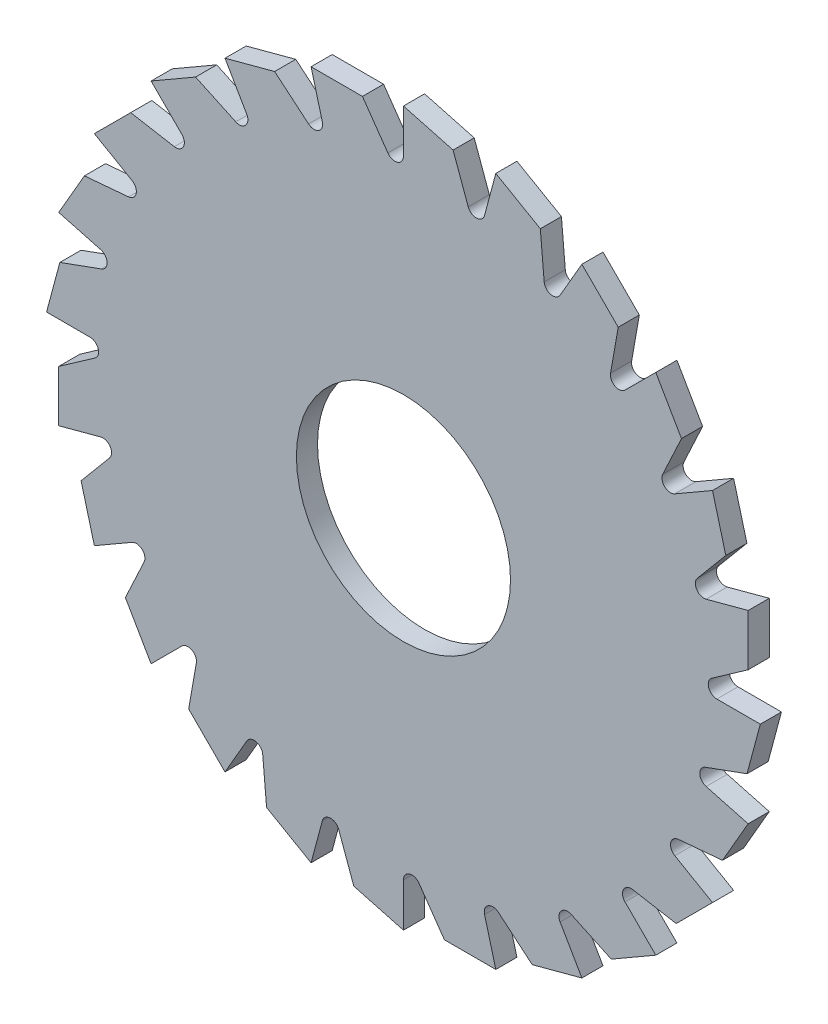
from build123d import *

# Parameters (mm, degrees)
SKETCH1_R           = 9.525
BOSS_EXTRUDE1_DEPTH = 1.8796


with BuildPart() as part:
    # Sketch1 → Boss-Extrude1 (new body)
    with BuildSketch(Plane.XY):
        with BuildLine():
            Line((4.416212878, 30.566679326), (0, 31.75))
            Line((0, 31.75), (0, 27.878579979))
            ThreePointArc((0, 27.878579979), (-0.532862181, 27.151847662), (-1.386193858, 27.441514734))
            Line((-1.386193858, 27.441514734), (-3.645504682, 30.668144985))
            Line((-3.645504682, 30.668144985), (-8.217504682, 30.668144985))
            Line((-8.217504682, 30.668144985), (-7.215507449, 26.928640402))
            ThreePointArc((-7.215507449, 26.928640402), (-7.542120627, 26.088756008), (-8.441347087, 26.147694424))
            Line((-8.441347087, 26.147694424), (-11.458787122, 28.679627244))
            Line((-11.458787122, 28.679627244), (-15.875, 27.49630657))
            Line((-15.875, 27.49630657), (-13.939289989, 24.143558483))
            ThreePointArc((-13.939289989, 24.143558483), (-14.037396016, 23.247758745), (-14.921236463, 23.071951949))
            Line((-14.921236463, 23.071951949), (-18.491172157, 24.736640303))
            Line((-18.491172157, 24.736640303), (-22.450640303, 22.450640303))
            Line((-22.450640303, 22.450640303), (-19.713132953, 19.713132953))
            ThreePointArc((-19.713132953, 19.713132953), (-19.576046065, 18.822465142), (-20.384268232, 18.423894078))
            Line((-20.384268232, 18.423894078), (-24.263414367, 19.107892204))
            Line((-24.263414367, 19.107892204), (-27.49630657, 15.875))
            Line((-27.49630657, 15.875), (-24.143558483, 13.939289989))
            ThreePointArc((-24.143558483, 13.939289989), (-23.780620926, 13.114451646), (-24.458145807, 12.520278272))
            Line((-24.458145807, 12.520278272), (-28.382144985, 12.176972828))
            Line((-28.382144985, 12.176972828), (-30.668144985, 8.217504682))
            Line((-30.668144985, 8.217504682), (-26.928640402, 7.215507449))
            ThreePointArc((-26.928640402, 7.215507449), (-26.364585769, 6.512709942), (-26.865241165, 5.763426192))
            Line((-26.865241165, 5.763426192), (-30.566679326, 4.416212878))
            Line((-30.566679326, 4.416212878), (-31.75, 0))
            Line((-31.75, 0), (-27.878579979, 0))
            ThreePointArc((-27.878579979, 0), (-27.151847662, -0.532862181), (-27.441514734, -1.386193858))
            Line((-27.441514734, -1.386193858), (-30.668144985, -3.645504682))
            Line((-30.668144985, -3.645504682), (-30.668144985, -8.217504682))
            Line((-30.668144985, -8.217504682), (-26.928640402, -7.215507449))
            ThreePointArc((-26.928640402, -7.215507449), (-26.088756008, -7.542120627), (-26.147694424, -8.441347087))
            Line((-26.147694424, -8.441347087), (-28.679627244, -11.458787122))
            Line((-28.679627244, -11.458787122), (-27.49630657, -15.875))
            Line((-27.49630657, -15.875), (-24.143558483, -13.939289989))
            ThreePointArc((-24.143558483, -13.939289989), (-23.247758745, -14.037396016), (-23.071951949, -14.921236463))
            Line((-23.071951949, -14.921236463), (-24.736640303, -18.491172157))
            Line((-24.736640303, -18.491172157), (-22.450640303, -22.450640303))
            Line((-22.450640303, -22.450640303), (-19.713132953, -19.713132953))
            ThreePointArc((-19.713132953, -19.713132953), (-18.822465142, -19.576046065), (-18.423894078, -20.384268232))
            Line((-18.423894078, -20.384268232), (-19.107892204, -24.263414367))
            Line((-19.107892204, -24.263414367), (-15.875, -27.49630657))
            Line((-15.875, -27.49630657), (-13.939289989, -24.143558483))
            ThreePointArc((-13.939289989, -24.143558483), (-13.114451646, -23.780620926), (-12.520278272, -24.458145807))
            Line((-12.520278272, -24.458145807), (-12.176972828, -28.382144985))
            Line((-12.176972828, -28.382144985), (-8.217504682, -30.668144985))
            Line((-8.217504682, -30.668144985), (-7.215507449, -26.928640402))
            ThreePointArc((-7.215507449, -26.928640402), (-6.512709942, -26.364585769), (-5.763426192, -26.865241165))
            Line((-5.763426192, -26.865241165), (-4.416212878, -30.566679326))
            Line((-4.416212878, -30.566679326), (0, -31.75))
            Line((0, -31.75), (0, -27.878579979))
            ThreePointArc((0, -27.878579979), (0.532862181, -27.151847662), (1.386193858, -27.441514734))
            Line((1.386193858, -27.441514734), (3.645504682, -30.668144985))
            Line((3.645504682, -30.668144985), (8.217504682, -30.668144985))
            Line((8.217504682, -30.668144985), (7.215507449, -26.928640402))
            ThreePointArc((7.215507449, -26.928640402), (7.542120627, -26.088756008), (8.441347087, -26.147694424))
            Line((8.441347087, -26.147694424), (11.458787122, -28.679627244))
            Line((11.458787122, -28.679627244), (15.875, -27.49630657))
            Line((15.875, -27.49630657), (13.939289989, -24.143558483))
            ThreePointArc((13.939289989, -24.143558483), (14.037396016, -23.247758745), (14.921236463, -23.071951949))
            Line((14.921236463, -23.071951949), (18.491172157, -24.736640303))
            Line((18.491172157, -24.736640303), (22.450640303, -22.450640303))
            Line((22.450640303, -22.450640303), (19.713132953, -19.713132953))
            ThreePointArc((19.713132953, -19.713132953), (19.576046065, -18.822465142), (20.384268232, -18.423894078))
            Line((20.384268232, -18.423894078), (24.263414367, -19.107892204))
            Line((24.263414367, -19.107892204), (27.49630657, -15.875))
            Line((27.49630657, -15.875), (24.143558483, -13.939289989))
            ThreePointArc((24.143558483, -13.939289989), (23.780620926, -13.114451646), (24.458145807, -12.520278272))
            Line((24.458145807, -12.520278272), (28.382144985, -12.176972828))
            Line((28.382144985, -12.176972828), (30.668144985, -8.217504682))
            Line((30.668144985, -8.217504682), (26.928640402, -7.215507449))
            ThreePointArc((26.928640402, -7.215507449), (26.364585769, -6.512709942), (26.865241165, -5.763426192))
            Line((26.865241165, -5.763426192), (30.566679326, -4.416212878))
            Line((30.566679326, -4.416212878), (31.75, 0))
            Line((31.75, 0), (27.878579979, 0))
            ThreePointArc((27.878579979, 0), (27.151847662, 0.532862181), (27.441514734, 1.386193858))
            Line((27.441514734, 1.386193858), (30.668144985, 3.645504682))
            Line((30.668144985, 3.645504682), (30.668144985, 8.217504682))
            Line((30.668144985, 8.217504682), (26.928640402, 7.215507449))
            ThreePointArc((26.928640402, 7.215507449), (26.088756008, 7.542120627), (26.147694424, 8.441347087))
            Line((26.147694424, 8.441347087), (28.679627244, 11.458787122))
            Line((28.679627244, 11.458787122), (27.49630657, 15.875))
            Line((27.49630657, 15.875), (24.143558483, 13.939289989))
            ThreePointArc((24.143558483, 13.939289989), (23.247758745, 14.037396016), (23.071951949, 14.921236463))
            Line((23.071951949, 14.921236463), (24.736640303, 18.491172157))
            Line((24.736640303, 18.491172157), (22.450640303, 22.450640303))
            Line((22.450640303, 22.450640303), (19.713132953, 19.713132953))
            ThreePointArc((19.713132953, 19.713132953), (18.822465142, 19.576046065), (18.423894078, 20.384268232))
            Line((18.423894078, 20.384268232), (19.107892204, 24.263414367))
            Line((19.107892204, 24.263414367), (15.875, 27.49630657))
            Line((15.875, 27.49630657), (13.939289989, 24.143558483))
            ThreePointArc((13.939289989, 24.143558483), (13.114451646, 23.780620926), (12.520278272, 24.458145807))
            Line((12.520278272, 24.458145807), (12.176972828, 28.382144985))
            Line((12.176972828, 28.382144985), (8.217504682, 30.668144985))
            Line((8.217504682, 30.668144985), (7.215507449, 26.928640402))
            ThreePointArc((7.215507449, 26.928640402), (6.512709942, 26.364585769), (5.763426192, 26.865241165))
            Line((5.763426192, 26.865241165), (4.416212878, 30.566679326))
        make_face()
        Circle(SKETCH1_R, mode=Mode.SUBTRACT)
    extrude(amount=BOSS_EXTRUDE1_DEPTH)


solid = part.part
